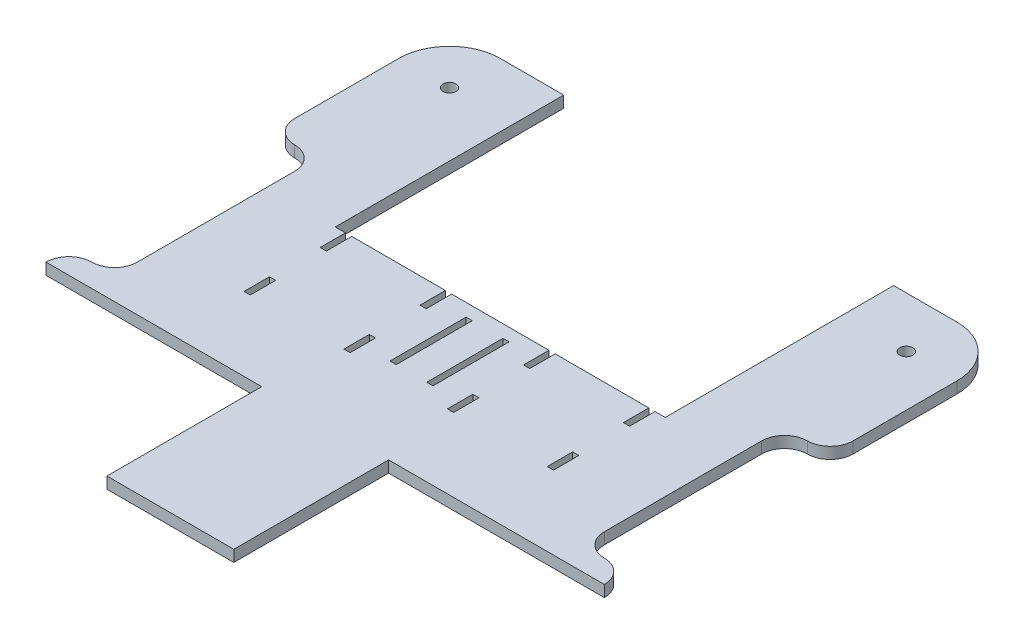
from build123d import *

# Parameters (mm, degrees)
SKETCH1_W           = 279.4
SKETCH1_H           = 279.4
BOSS_EXTRUDE1_DEPTH = 5.715
CUT_EXTRUDE2_REACH  = 199.648
SKETCH4_W           = 22.86
SKETCH4_H           = 101.6
FILLET1_START       = -1
FILLET1_DEPTH       = 8
FILLET1_2_DEPTH     = 5.715
CUT_EXTRUDE3_REACH  = 199.648
SKETCH5_W           = 3.0988
SKETCH5_H           = 12.7
CUT_EXTRUDE4_REACH  = 199.648
SKETCH6_R           = 3.2639
FILLET2_R           = 25.4
CUT_EXTRUDE5_REACH  = 199.648
SKETCH7_W           = 165.1
SKETCH7_H           = 114.3
CUT_EXTRUDE7_REACH  = 199.648
SKETCH16_W          = 3.0988
SKETCH16_H          = 38.1
CUT_EXTRUDE11_REACH = 199.648
SKETCH26_W          = 107.95
SKETCH26_H          = 77.47


with BuildPart() as part:
    # Sketch1 → Boss-Extrude1 (new body)
    with BuildSketch(Plane(origin=(0, 0, 0), x_dir=(1, 0, 0), z_dir=(0, 1, 0))):
        Rectangle(SKETCH1_W, SKETCH1_H)
    extrude(amount=BOSS_EXTRUDE1_DEPTH)

    # Sketch4 → Cut-Extrude2 (cut, up to next)
    with BuildSketch(Plane(origin=(0, 5.715, 0), x_dir=(1, 0, 0), z_dir=(0, 1, 0)), mode=Mode.PRIVATE) as cut_extrude2_sk1:
        with Locations((-128.27, 0)):
            Rectangle(SKETCH4_W, SKETCH4_H)
    cut_extrude2_tool1 = extrude(cut_extrude2_sk1.sketch, amount=-CUT_EXTRUDE2_REACH, mode=Mode.PRIVATE) & part.part
    # Sketch4 → Cut-Extrude2 (cut, up to next)
    with BuildSketch(Plane(origin=(0, 5.715, 0), x_dir=(1, 0, 0), z_dir=(0, 1, 0)), mode=Mode.PRIVATE) as cut_extrude2_sk2:
        with Locations((128.27, 0)):
            Rectangle(SKETCH4_W, SKETCH4_H)
    cut_extrude2_tool2 = extrude(cut_extrude2_sk2.sketch, amount=-CUT_EXTRUDE2_REACH, mode=Mode.PRIVATE) & part.part
    add(cut_extrude2_tool1.solids().sort_by_distance((-128.27, 5.715, 0))[0], mode=Mode.SUBTRACT)
    add(cut_extrude2_tool2.solids().sort_by_distance((128.27, 5.715, 0))[0], mode=Mode.SUBTRACT)

    # Fillet1: read off the stored shape, not the designer's step
    # Fillet1 outline → Fillet1 (cut)
    with BuildSketch(Plane(origin=(0, 0, 0), x_dir=(1, 0, 0), z_dir=(0, 1, 0)).offset(FILLET1_START)):
        with BuildLine():
            ThreePointArc((-139.7, -62.23), (-136.352230509, -54.147769491), (-128.27, -50.8))
            Line((-128.27, -50.8), (-139.7, -50.8))
            Line((-139.7, -50.8), (-139.7, -62.23))
        make_face()
        with BuildLine():
            ThreePointArc((-128.27, 50.8), (-136.352230509, 54.147769491), (-139.7, 62.23))
            Line((-139.7, 62.23), (-139.7, 50.8))
            Line((-139.7, 50.8), (-128.27, 50.8))
        make_face()
        with BuildLine():
            Line((139.7, -50.8), (128.27, -50.8))
            ThreePointArc((128.27, -50.8), (136.352230509, -54.147769491), (139.7, -62.23))
            Line((139.7, -62.23), (139.7, -50.8))
        make_face()
        with BuildLine():
            ThreePointArc((139.7, 62.23), (136.352230509, 54.147769491), (128.27, 50.8))
            Line((128.27, 50.8), (139.7, 50.8))
            Line((139.7, 50.8), (139.7, 62.23))
        make_face()
    extrude(amount=FILLET1_DEPTH, mode=Mode.SUBTRACT)

    # Fillet1 2 outline → Fillet1 2 (add)
    with BuildSketch(Plane(origin=(0, 0, 0), x_dir=(1, 0, 0), z_dir=(0, 1, 0))):
        with BuildLine():
            Line((-116.84, -50.8), (-116.84, -39.37))
            ThreePointArc((-116.84, -39.37), (-120.187769491, -47.452230509), (-128.27, -50.8))
            Line((-128.27, -50.8), (-116.84, -50.8))
        make_face()
        with BuildLine():
            Line((-116.84, 50.8), (-128.27, 50.8))
            ThreePointArc((-128.27, 50.8), (-120.187769491, 47.452230509), (-116.84, 39.37))
            Line((-116.84, 39.37), (-116.84, 50.8))
        make_face()
        with BuildLine():
            Line((116.84, -50.8), (128.27, -50.8))
            ThreePointArc((128.27, -50.8), (120.187769491, -47.452230509), (116.84, -39.37))
            Line((116.84, -39.37), (116.84, -50.8))
        make_face()
        with BuildLine():
            Line((116.84, 50.8), (116.84, 39.37))
            ThreePointArc((116.84, 39.37), (120.187769491, 47.452230509), (128.27, 50.8))
            Line((128.27, 50.8), (116.84, 50.8))
        make_face()
    extrude(amount=FILLET1_2_DEPTH)

    # Sketch5 → Cut-Extrude3 (cut, up to next)
    with BuildSketch(Plane(origin=(0, 0, 0), x_dir=(-1, 0, 0), z_dir=(0, -1, 0)), mode=Mode.PRIVATE) as cut_extrude3_sk1:
        with Locations((75.8825, -19.05)):
            Rectangle(SKETCH5_W, SKETCH5_H)
    cut_extrude3_tool1 = extrude(cut_extrude3_sk1.sketch, amount=-CUT_EXTRUDE3_REACH, mode=Mode.PRIVATE) & part.part
    # Sketch5 → Cut-Extrude3 (cut, up to next)
    with BuildSketch(Plane(origin=(0, 0, 0), x_dir=(-1, 0, 0), z_dir=(0, -1, 0)), mode=Mode.PRIVATE) as cut_extrude3_sk2:
        with Locations((75.8825, 19.05)):
            Rectangle(SKETCH5_W, SKETCH5_H)
    cut_extrude3_tool2 = extrude(cut_extrude3_sk2.sketch, amount=-CUT_EXTRUDE3_REACH, mode=Mode.PRIVATE) & part.part
    # Sketch5 → Cut-Extrude3 (cut, up to next)
    with BuildSketch(Plane(origin=(0, 0, 0), x_dir=(-1, 0, 0), z_dir=(0, -1, 0)), mode=Mode.PRIVATE) as cut_extrude3_sk3:
        with Locations((-75.8825, 19.05)):
            Rectangle(SKETCH5_W, SKETCH5_H)
    cut_extrude3_tool3 = extrude(cut_extrude3_sk3.sketch, amount=-CUT_EXTRUDE3_REACH, mode=Mode.PRIVATE) & part.part
    # Sketch5 → Cut-Extrude3 (cut, up to next)
    with BuildSketch(Plane(origin=(0, 0, 0), x_dir=(-1, 0, 0), z_dir=(0, -1, 0)), mode=Mode.PRIVATE) as cut_extrude3_sk4:
        with Locations((-75.8825, -19.05)):
            Rectangle(SKETCH5_W, SKETCH5_H)
    cut_extrude3_tool4 = extrude(cut_extrude3_sk4.sketch, amount=-CUT_EXTRUDE3_REACH, mode=Mode.PRIVATE) & part.part
    # Sketch5 → Cut-Extrude3 (cut, up to next)
    with BuildSketch(Plane(origin=(0, 0, 0), x_dir=(-1, 0, 0), z_dir=(0, -1, 0)), mode=Mode.PRIVATE) as cut_extrude3_sk5:
        with Locations((25.908, -19.05)):
            Rectangle(SKETCH5_W, SKETCH5_H)
    cut_extrude3_tool5 = extrude(cut_extrude3_sk5.sketch, amount=-CUT_EXTRUDE3_REACH, mode=Mode.PRIVATE) & part.part
    # Sketch5 → Cut-Extrude3 (cut, up to next)
    with BuildSketch(Plane(origin=(0, 0, 0), x_dir=(-1, 0, 0), z_dir=(0, -1, 0)), mode=Mode.PRIVATE) as cut_extrude3_sk6:
        with Locations((25.908, 19.05)):
            Rectangle(SKETCH5_W, SKETCH5_H)
    cut_extrude3_tool6 = extrude(cut_extrude3_sk6.sketch, amount=-CUT_EXTRUDE3_REACH, mode=Mode.PRIVATE) & part.part
    # Sketch5 → Cut-Extrude3 (cut, up to next)
    with BuildSketch(Plane(origin=(0, 0, 0), x_dir=(-1, 0, 0), z_dir=(0, -1, 0)), mode=Mode.PRIVATE) as cut_extrude3_sk7:
        with Locations((-25.908, 19.05)):
            Rectangle(SKETCH5_W, SKETCH5_H)
    cut_extrude3_tool7 = extrude(cut_extrude3_sk7.sketch, amount=-CUT_EXTRUDE3_REACH, mode=Mode.PRIVATE) & part.part
    # Sketch5 → Cut-Extrude3 (cut, up to next)
    with BuildSketch(Plane(origin=(0, 0, 0), x_dir=(-1, 0, 0), z_dir=(0, -1, 0)), mode=Mode.PRIVATE) as cut_extrude3_sk8:
        with Locations((-25.908, -19.05)):
            Rectangle(SKETCH5_W, SKETCH5_H)
    cut_extrude3_tool8 = extrude(cut_extrude3_sk8.sketch, amount=-CUT_EXTRUDE3_REACH, mode=Mode.PRIVATE) & part.part
    add(cut_extrude3_tool1.solids().sort_by_distance((-75.8825, 0, 19.05))[0], mode=Mode.SUBTRACT)
    add(cut_extrude3_tool2.solids().sort_by_distance((-75.8825, 0, -19.05))[0], mode=Mode.SUBTRACT)
    add(cut_extrude3_tool3.solids().sort_by_distance((75.8825, 0, -19.05))[0], mode=Mode.SUBTRACT)
    add(cut_extrude3_tool4.solids().sort_by_distance((75.8825, 0, 19.05))[0], mode=Mode.SUBTRACT)
    add(cut_extrude3_tool5.solids().sort_by_distance((-25.908, 0, 19.05))[0], mode=Mode.SUBTRACT)
    add(cut_extrude3_tool6.solids().sort_by_distance((-25.908, 0, -19.05))[0], mode=Mode.SUBTRACT)
    add(cut_extrude3_tool7.solids().sort_by_distance((25.908, 0, -19.05))[0], mode=Mode.SUBTRACT)
    add(cut_extrude3_tool8.solids().sort_by_distance((25.908, 0, 19.05))[0], mode=Mode.SUBTRACT)

    # Sketch6 → Cut-Extrude4 (cut, up to next)
    with BuildSketch(Plane(origin=(0, 5.715, 0), x_dir=(1, 0, 0), z_dir=(0, 1, 0)), mode=Mode.PRIVATE) as cut_extrude4_sk1:
        with Locations(Location((-114.3, 114.3, 0), (0, 0, 270))):
            Circle(SKETCH6_R)
    cut_extrude4_tool1 = extrude(cut_extrude4_sk1.sketch, amount=-CUT_EXTRUDE4_REACH, mode=Mode.PRIVATE) & part.part
    # Sketch6 → Cut-Extrude4 (cut, up to next)
    with BuildSketch(Plane(origin=(0, 5.715, 0), x_dir=(1, 0, 0), z_dir=(0, 1, 0)), mode=Mode.PRIVATE) as cut_extrude4_sk2:
        with Locations(Location((114.3, 114.3, 0), (0, 0, 270))):
            Circle(SKETCH6_R)
    cut_extrude4_tool2 = extrude(cut_extrude4_sk2.sketch, amount=-CUT_EXTRUDE4_REACH, mode=Mode.PRIVATE) & part.part
    # Sketch6 → Cut-Extrude4 (cut, up to next)
    with BuildSketch(Plane(origin=(0, 5.715, 0), x_dir=(1, 0, 0), z_dir=(0, 1, 0)), mode=Mode.PRIVATE) as cut_extrude4_sk3:
        with Locations(Location((114.3, -114.3, 0), (0, 0, 270))):
            Circle(SKETCH6_R)
    cut_extrude4_tool3 = extrude(cut_extrude4_sk3.sketch, amount=-CUT_EXTRUDE4_REACH, mode=Mode.PRIVATE) & part.part
    # Sketch6 → Cut-Extrude4 (cut, up to next)
    with BuildSketch(Plane(origin=(0, 5.715, 0), x_dir=(1, 0, 0), z_dir=(0, 1, 0)), mode=Mode.PRIVATE) as cut_extrude4_sk4:
        with Locations(Location((-114.3, -114.3, 0), (0, 0, 270))):
            Circle(SKETCH6_R)
    cut_extrude4_tool4 = extrude(cut_extrude4_sk4.sketch, amount=-CUT_EXTRUDE4_REACH, mode=Mode.PRIVATE) & part.part
    add(cut_extrude4_tool1.solids().sort_by_distance((-114.3, 5.715, -114.3))[0], mode=Mode.SUBTRACT)
    add(cut_extrude4_tool2.solids().sort_by_distance((114.3, 5.715, -114.3))[0], mode=Mode.SUBTRACT)
    add(cut_extrude4_tool3.solids().sort_by_distance((114.3, 5.715, 114.3))[0], mode=Mode.SUBTRACT)
    add(cut_extrude4_tool4.solids().sort_by_distance((-114.3, 5.715, 114.3))[0], mode=Mode.SUBTRACT)

    # Fillet2
    fillet2_edges = [part.edges().sort_by_distance(p)[0] for p in [
        (-139.7, 2.8575, -139.7),
        (139.7, 2.8575, -139.7),
        (139.7, 2.8575, 139.7),
        (-139.7, 2.8575, 139.7),
    ]]
    fillet(fillet2_edges, radius=FILLET2_R)

    # Sketch7 → Cut-Extrude5 (cut, up to next)
    with BuildSketch(Plane(origin=(0, 5.715, 0), x_dir=(1, 0, 0), z_dir=(0, 1, 0)), mode=Mode.PRIVATE) as cut_extrude5_sk1:
        with Locations((0, 82.55)):
            Rectangle(SKETCH7_W, SKETCH7_H)
    cut_extrude5_tool1 = extrude(cut_extrude5_sk1.sketch, amount=-CUT_EXTRUDE5_REACH, mode=Mode.PRIVATE) & part.part
    add(cut_extrude5_tool1.solids().sort_by_distance((0, 5.715, -82.55))[0], mode=Mode.SUBTRACT)

    # Sketch16 → Cut-Extrude7 (cut, up to next)
    with BuildSketch(Plane(origin=(0, 5.715, 0), x_dir=(1, 0, 0), z_dir=(0, 1, 0)), mode=Mode.PRIVATE) as cut_extrude7_sk1:
        with Locations((-9.1948, 0)):
            Rectangle(SKETCH16_W, SKETCH16_H)
    cut_extrude7_tool1 = extrude(cut_extrude7_sk1.sketch, amount=-CUT_EXTRUDE7_REACH, mode=Mode.PRIVATE) & part.part
    # Sketch16 → Cut-Extrude7 (cut, up to next)
    with BuildSketch(Plane(origin=(0, 5.715, 0), x_dir=(1, 0, 0), z_dir=(0, 1, 0)), mode=Mode.PRIVATE) as cut_extrude7_sk2:
        with Locations((9.1948, 0)):
            Rectangle(SKETCH16_W, SKETCH16_H)
    cut_extrude7_tool2 = extrude(cut_extrude7_sk2.sketch, amount=-CUT_EXTRUDE7_REACH, mode=Mode.PRIVATE) & part.part
    add(cut_extrude7_tool1.solids().sort_by_distance((-9.1948, 5.715, 0))[0], mode=Mode.SUBTRACT)
    add(cut_extrude7_tool2.solids().sort_by_distance((9.1948, 5.715, 0))[0], mode=Mode.SUBTRACT)

    # Sketch26 → Cut-Extrude11 (cut, up to next)
    with BuildSketch(Plane(origin=(0, 5.715, 0), x_dir=(1, 0, 0), z_dir=(0, 1, 0)), mode=Mode.PRIVATE) as cut_extrude11_sk1:
        with Locations((-85.725, -100.965)):
            Rectangle(SKETCH26_W, SKETCH26_H)
    cut_extrude11_tool1 = extrude(cut_extrude11_sk1.sketch, amount=-CUT_EXTRUDE11_REACH, mode=Mode.PRIVATE) & part.part
    # Sketch26 → Cut-Extrude11 (cut, up to next)
    with BuildSketch(Plane(origin=(0, 5.715, 0), x_dir=(1, 0, 0), z_dir=(0, 1, 0)), mode=Mode.PRIVATE) as cut_extrude11_sk2:
        with Locations((85.725, -100.965)):
            Rectangle(SKETCH26_W, SKETCH26_H)
    cut_extrude11_tool2 = extrude(cut_extrude11_sk2.sketch, amount=-CUT_EXTRUDE11_REACH, mode=Mode.PRIVATE) & part.part
    add(cut_extrude11_tool1.solids().sort_by_distance((-85.725, 5.715, 100.965))[0], mode=Mode.SUBTRACT)
    add(cut_extrude11_tool2.solids().sort_by_distance((85.725, 5.715, 100.965))[0], mode=Mode.SUBTRACT)


solid = part.part
